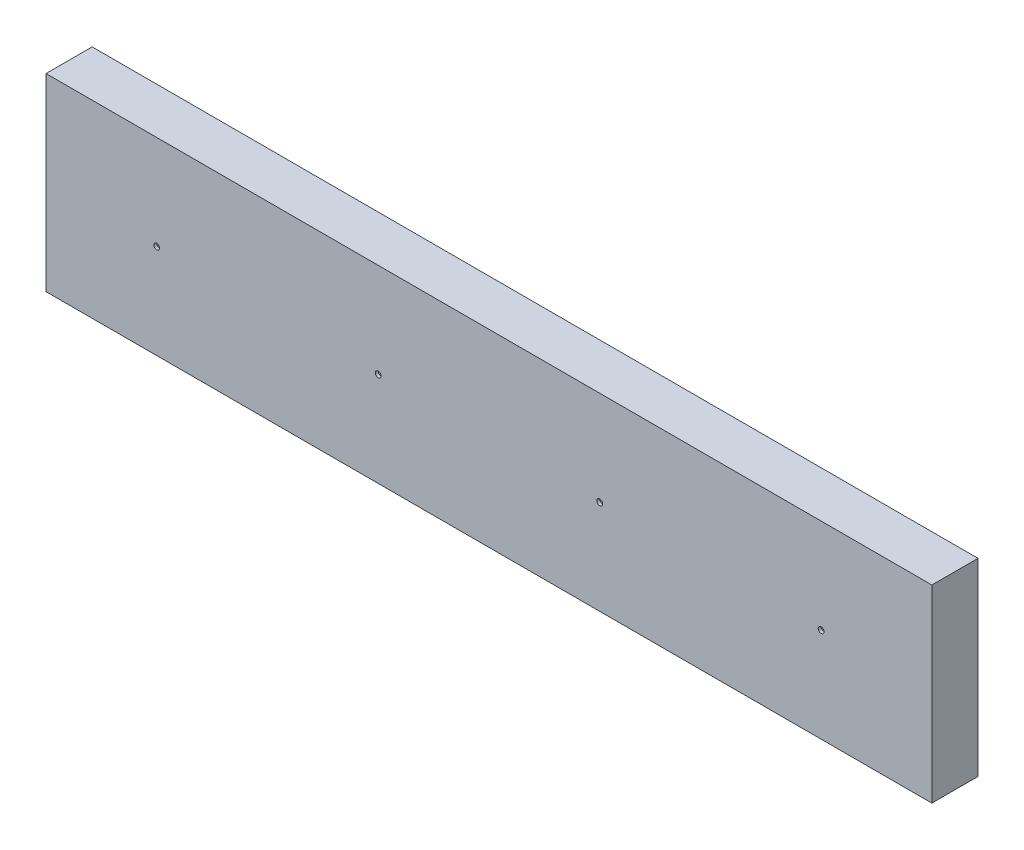
from build123d import *

# Parameters (mm, degrees)
SKETCH1_W               = 304.8
SKETCH1_H               = 65
BOSS_EXTRUDE1_DEPTH     = 15.875
CUT_EXTRUDE1_DEPTH      = 157.633411586
CUT_EXTRUDE1_DEPTH_BACK = 1
SKETCH2_R               = 1


with BuildPart() as part:
    # Sketch1 → Boss-Extrude1 (new body)
    with BuildSketch(Plane.XY):
        Rectangle(SKETCH1_W, SKETCH1_H)
    extrude(amount=BOSS_EXTRUDE1_DEPTH)

    # Sketch2 → Cut-Extrude1 (cut, two sides: drawn at the far end of the back side and taken through both)
    with BuildSketch(Plane.XY.offset(15.875).offset(-CUT_EXTRUDE1_DEPTH_BACK)):
        with Locations((-38.1, 0)):
            Circle(SKETCH2_R)
        with Locations((-114.3, 0)):
            Circle(SKETCH2_R)
        with Locations((114.3, 0)):
            Circle(SKETCH2_R)
        with Locations((38.1, 0)):
            Circle(SKETCH2_R)
    extrude(amount=CUT_EXTRUDE1_DEPTH + CUT_EXTRUDE1_DEPTH_BACK, mode=Mode.SUBTRACT)


solid = part.part
